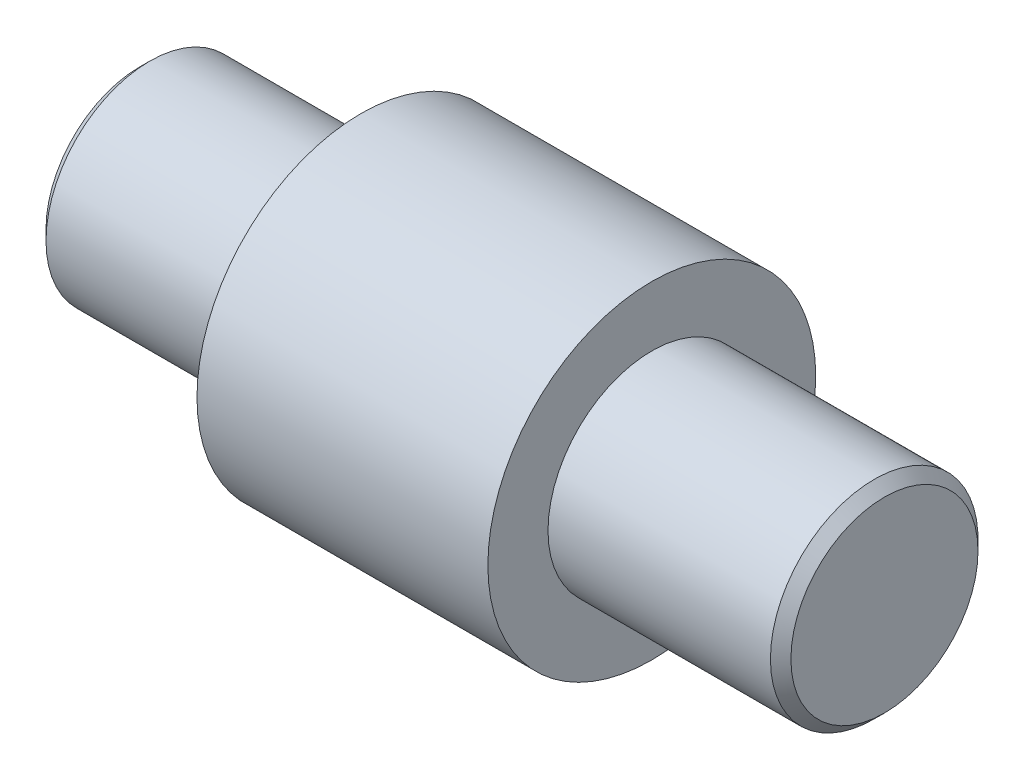
from build123d import *

# Parameters (mm, degrees)
CHANFREIN1_SIZE = 1


with BuildPart() as part:
    # Esquisse1 → Révolution1 (revolve)
    with BuildSketch(Plane.XY):
        Polygon((53.607042996, -119.985268257), (82, -119.985268257), (82, -125.85483319), (104.709234828, -125.85483319), (104.709234828, -135.985268257), (82, -135.985268257), (32, -135.985268257), (32, -125.85483319), (53.607042996, -125.85483319), align=None)
    revolve(axis=Axis((45.793202263, -135.985268257, 0), (1, 0, 0)))

    # Chanfrein1
    chanfrein1_edges = [part.edges().sort_by_distance(p)[0] for p in [
        (104.709234828, -146.115703324, 0),
        (32, -146.115703324, 0),
    ]]
    chamfer(chanfrein1_edges, length=CHANFREIN1_SIZE)


solid = part.part
